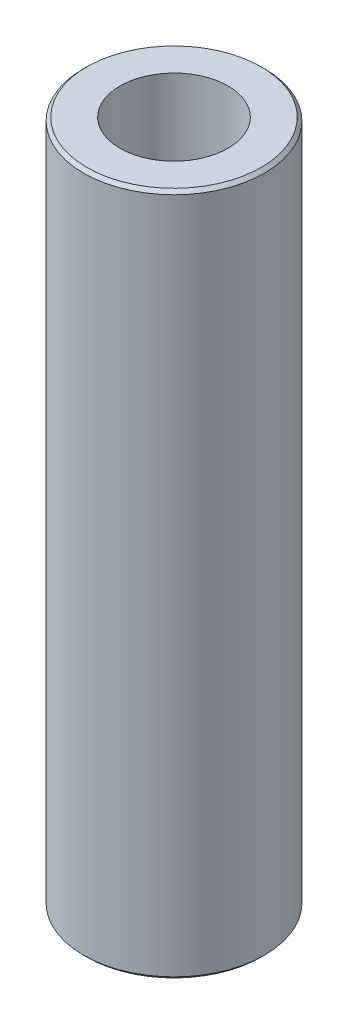
from build123d import *

# Parameters (mm, degrees)
SKETCH1_R           = 10
BOSS_EXTRUDE1_DEPTH = 75.590684089
SKETCH2_R           = 5.97253217
CUT_EXTRUDE1_DEPTH  = 77.902220521
CHAMFER1_SIZE       = 0.363570725


with BuildPart() as part:
    # Sketch1 → Boss-Extrude1 (new body)
    with BuildSketch(Plane(origin=(0, 0, 0), x_dir=(1, 0, 0), z_dir=(0, 1, 0))):
        Circle(SKETCH1_R)
    extrude(amount=BOSS_EXTRUDE1_DEPTH)

    # Sketch2 → Cut-Extrude1 (cut, through all)
    with BuildSketch(Plane(origin=(0, 0, 0), x_dir=(1, 0, 0), z_dir=(0, 1, 0))):
        Circle(SKETCH2_R)
    extrude(amount=CUT_EXTRUDE1_DEPTH, mode=Mode.SUBTRACT)

    # Chamfer1
    chamfer1_edges = [part.edges().sort_by_distance(p)[0] for p in [
        (-10, 75.590684089, 0),
        (-10, 0, 0),
    ]]
    chamfer(chamfer1_edges, length=CHAMFER1_SIZE)


solid = part.part
